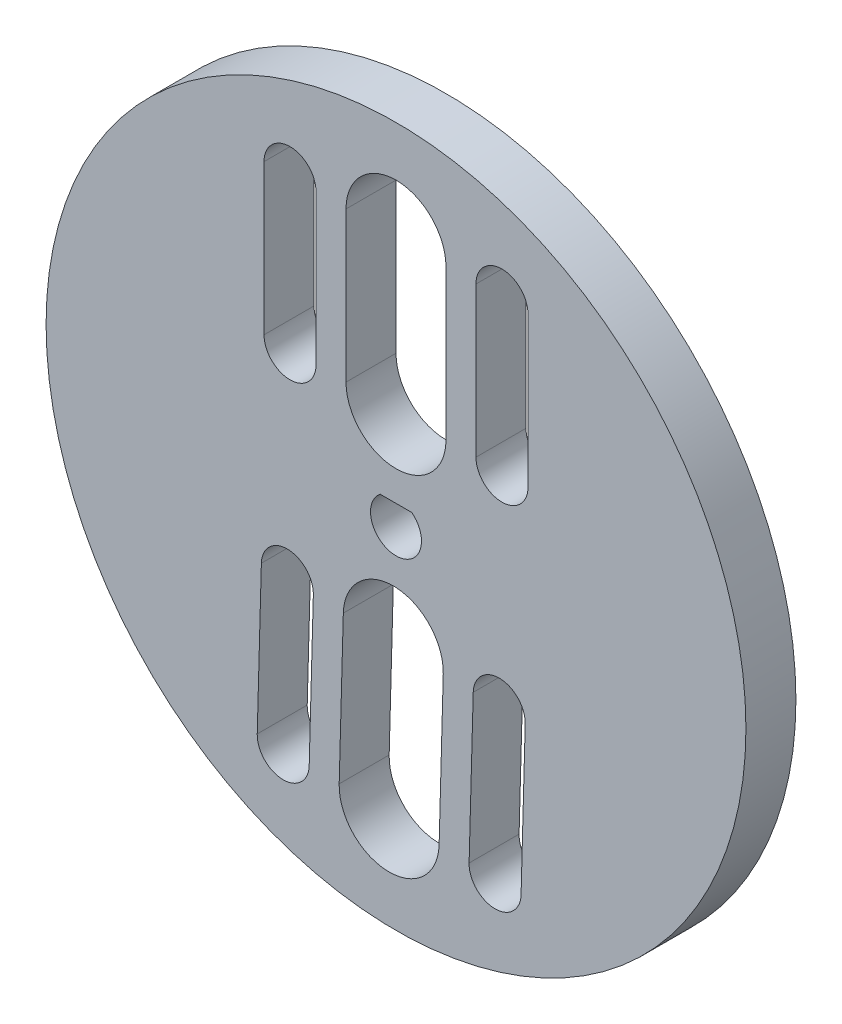
from build123d import *

# Parameters (mm, degrees)
ESQUISSE1_R             = 35
BOSS_EXTRU_1_DEPTH      = 5
ENL_V_MAT_EXTRU_1_REACH = 51.749


with BuildPart() as part:
    # Esquisse1 → Boss.-Extru.1 (new body)
    with BuildSketch(Plane.XY):
        Circle(ESQUISSE1_R)
        with BuildLine():
            ThreePointArc((4.728110875, -10.282810642), (4.727635283, -10.351772147), (4.726208599, -10.420720532))
            Line((4.726208599, -10.420720532), (4.312478928, -25.415013705))
            ThreePointArc((4.312478928, -25.415013705), (-0.823528687, -30.275201539), (-5.683716521, -25.139193925))
            Line((-5.683716521, -25.139193925), (-5.26998685, -10.144900751))
            ThreePointArc((-5.26998685, -10.144900751), (-0.202927621, -5.283286233), (4.728110875, -10.282810642))
        make_face(mode=Mode.SUBTRACT)
        with BuildLine():
            Line((-8.268845484, -10.062154817), (-8.682575156, -25.05644799))
            ThreePointArc((-8.682575156, -25.05644799), (-11.353299115, -27.583745664), (-13.880596789, -24.913021704))
            Line((-13.880596789, -24.913021704), (-13.466867118, -9.918728531))
            ThreePointArc((-13.466867118, -9.918728531), (-10.796143158, -7.391430858), (-8.268845484, -10.062154817))
        make_face(mode=Mode.SUBTRACT)
        with BuildLine():
            Line((12.923088867, -10.646892753), (12.509359196, -25.641185926))
            ThreePointArc((12.509359196, -25.641185926), (9.838635236, -28.168483599), (7.311337562, -25.49775964))
            Line((7.311337562, -25.49775964), (7.725067233, -10.503466467))
            ThreePointArc((7.725067233, -10.503466467), (10.395791193, -7.976168793), (12.923088867, -10.646892753))
        make_face(mode=Mode.SUBTRACT)
        with BuildLine():
            Line((-13.2, 10), (-13.2, 25))
            ThreePointArc((-13.2, 25), (-10.6, 27.6), (-8, 25))
            Line((-8, 25), (-8, 10))
            ThreePointArc((-8, 10), (-10.6, 7.4), (-13.2, 10))
        make_face(mode=Mode.SUBTRACT)
        with BuildLine():
            ThreePointArc((5, 10), (0, 5), (-5, 10))
            Line((-5, 10), (-5, 25))
            ThreePointArc((-5, 25), (0, 30), (5, 25))
            Line((5, 25), (5, 10))
        make_face(mode=Mode.SUBTRACT)
        with BuildLine():
            ThreePointArc((8, 25), (10.6, 27.6), (13.2, 25))
            Line((13.2, 25), (13.2, 10))
            ThreePointArc((13.2, 10), (10.6, 7.4), (8, 10))
            Line((8, 10), (8, 25))
        make_face(mode=Mode.SUBTRACT)
    extrude(amount=BOSS_EXTRU_1_DEPTH)

    # Esquisse2 → Enlèv. mat.-Extru.1 (cut, up to next)
    with BuildSketch(Plane.XY.offset(5), mode=Mode.PRIVATE) as enl_v_mat_extru_1_sk1:
        with BuildLine():
            Line((1.581929202, 2), (-1.581929202, 2))
            ThreePointArc((-1.581929202, 2), (-1.110986169, -2.295258097), (2.55, 0))
            ThreePointArc((2.55, 0), (2.295258097, 1.110986169), (1.581929202, 2))
        make_face()
    enl_v_mat_extru_1_tool1 = extrude(enl_v_mat_extru_1_sk1.sketch, amount=-ENL_V_MAT_EXTRU_1_REACH, mode=Mode.PRIVATE) & part.part
    add(enl_v_mat_extru_1_tool1.solids().sort_by_distance((0, -0.137168, 5))[0], mode=Mode.SUBTRACT)


solid = part.part
